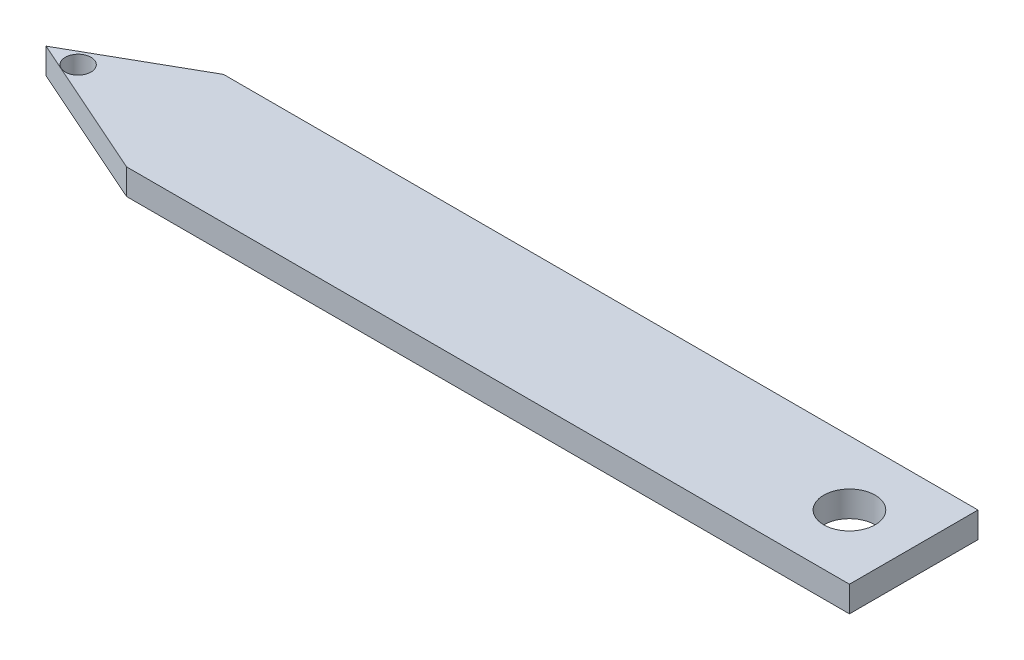
from build123d import *

# Parameters (mm, degrees)
SKETCH1_W           = 67.5
SKETCH1_H           = 10
SKETCH1_R           = 1
SKETCH1_R_2         = 2
BOSS_EXTRUDE1_DEPTH = 2
FILLET2_R           = 5
FILLET3_R           = 5
CUT_EXTRUDE1_DEPTH  = 10


with BuildPart() as part:
    # Sketch1 → Boss-Extrude1 (new body)
    with BuildSketch(Plane(origin=(0, 0, 0), x_dir=(1, 0, 0), z_dir=(0, 1, 0))):
        with Locations((7.54504806, 0.629386767)):
            Rectangle(SKETCH1_W, SKETCH1_H)
        with Locations(Location((-23.70495194, 0.629386767, 0), (0, 0, 270))):
            Circle(SKETCH1_R, mode=Mode.SUBTRACT)
        with Locations(Location((36.29504806, 0.629386767, 0), (0, 0, 270))):
            Circle(SKETCH1_R_2, mode=Mode.SUBTRACT)
    extrude(amount=BOSS_EXTRUDE1_DEPTH)

    # Fillet2
    fillet2_edges = [part.edges().sort_by_distance(p)[0] for p in [
        (-26.20495194, 1, -5.629386767),
    ]]
    fillet(fillet2_edges, radius=FILLET2_R)

    # Fillet3
    fillet3_edges = [part.edges().sort_by_distance(p)[0] for p in [
        (-26.20495194, 1, 4.370613233),
    ]]
    fillet(fillet3_edges, radius=FILLET3_R - 0.0001)  # a hair under: the kernel refuses the full size

    # Sketch2 → Cut-Extrude1 (cut)
    with BuildSketch(Plane(origin=(0, 2, 0), x_dir=(1, 0, 0), z_dir=(0, 1, 0))):
        Polygon((-26.20495194, 0.629386767), (-17.3953026, 5.629386767), (-30.276307772, 5.629386767), (-27.957364893, -6.288007195), (-14.932537807, -4.370613233), align=None)
    extrude(amount=-CUT_EXTRUDE1_DEPTH, mode=Mode.SUBTRACT)


solid = part.part
